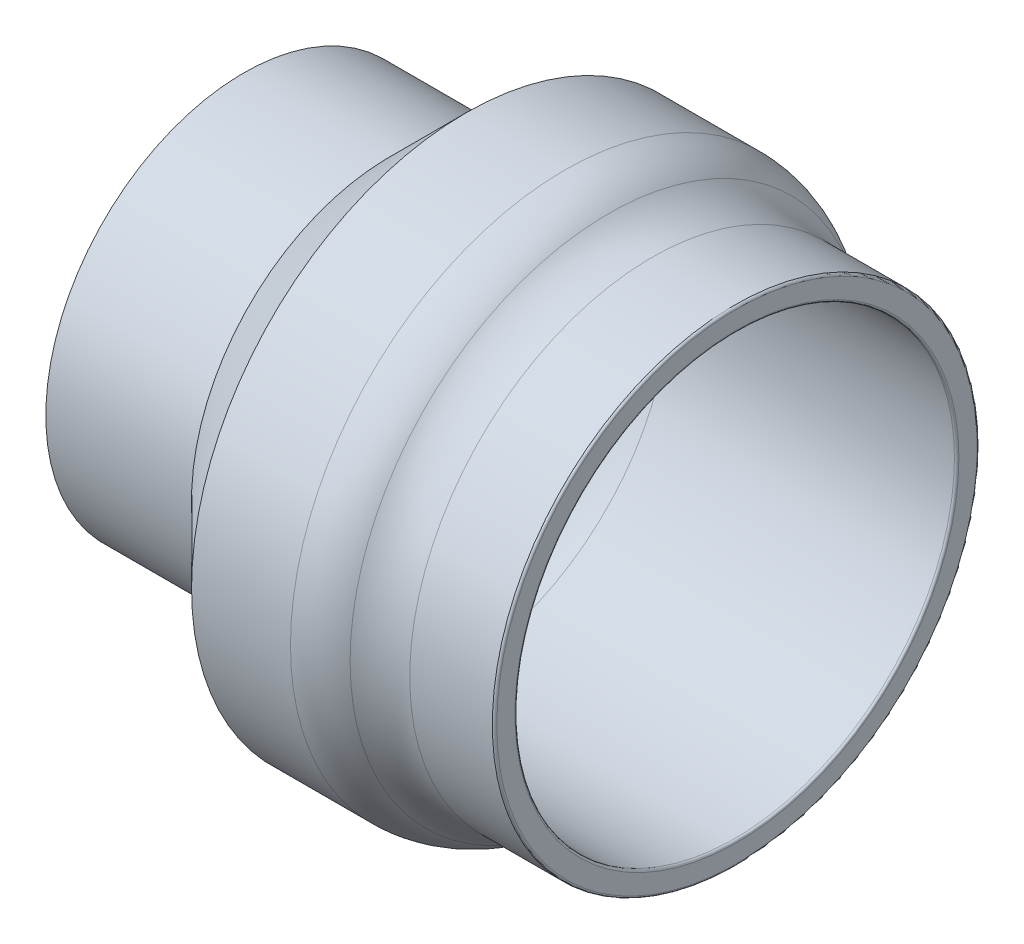
from build123d import *

# Parameters (mm, degrees)
SKETCH1_R           = 8.825
SKETCH1_R_2         = 7.825
BOSS_EXTRUDE1_DEPTH = 10
SKETCH2_R           = 12.24
SKETCH2_R_2         = 7.825
BOSS_EXTRUDE2_DEPTH = 12
CHAMFER1_SIZE       = 3.5
SKETCH3_R           = 9.8
CUT_EXTRUDE1_DEPTH  = 12
CHAMFER2_SIZE       = 4
FILLET1_R           = 3
SKETCH4_R           = 12.810143369
SKETCH4_R_2         = 10.810143369
CUT_EXTRUDE2_DEPTH  = 7
CHAMFER3_SIZE       = 2
FILLET2_R           = 3
FILLET3_R           = 3
FILLET4_R           = 0.1


with BuildPart() as part:
    # Sketch1 → Boss-Extrude1 (new body)
    with BuildSketch(Plane(origin=(0, 0, 0), x_dir=(0, 0, -1), z_dir=(1, 0, 0))):
        Circle(SKETCH1_R)
        Circle(SKETCH1_R_2, mode=Mode.SUBTRACT)
    extrude(amount=BOSS_EXTRUDE1_DEPTH)

    # Sketch2 → Boss-Extrude2 (add)
    with BuildSketch(Plane(origin=(10, 0, 0), x_dir=(0, 0, -1), z_dir=(1, 0, 0))):
        Circle(SKETCH2_R)
        Circle(SKETCH2_R_2, mode=Mode.SUBTRACT)
    extrude(amount=BOSS_EXTRUDE2_DEPTH)

    # Chamfer1
    # the kernel refuses this chamfer: 3.5 mm, written as the material it adds along each edge
    with BuildSketch(Plane(origin=(10, 0, 0), x_dir=(0, 0, -1), z_dir=(0, -1, 0))) as chamfer1_piece_1_section:
        Polygon((8.825, -CHAMFER1_SIZE), (8.825 + CHAMFER1_SIZE, 0), (8.825, 0), align=None)
    chamfer1_piece_1 = revolve(axis=Axis((10, 0, 0), (1, 0, 0)), mode=Mode.PRIVATE)
    chamfer1_piece_1 = chamfer1_piece_1 & Plane(origin=(8.210974628, 0, 0), x_dir=(0, 0, -1), z_dir=(-1, 0, 0)) * Cylinder(12.24, 50, mode=Mode.PRIVATE)
    add(chamfer1_piece_1)

    # Sketch3 → Cut-Extrude1 (cut)
    with BuildSketch(Plane(origin=(22, 0, 0), x_dir=(0, 0, -1), z_dir=(1, 0, 0))):
        Circle(SKETCH3_R)
    extrude(amount=-CUT_EXTRUDE1_DEPTH, mode=Mode.SUBTRACT)

    # Chamfer2
    # the kernel refuses this chamfer: 4 mm, written as the material it takes off along each edge
    with BuildSketch(Plane(origin=(10, 0, 0), x_dir=(0, 0, -1), z_dir=(0, 1, 0))) as chamfer2_piece_1_section:
        Polygon((7.825, CHAMFER2_SIZE), (7.825 + CHAMFER2_SIZE, 0), (7.825, 0), align=None)
    chamfer2_piece_1 = revolve(axis=Axis((10, 0, 0), (-1, 0, 0)), mode=Mode.PRIVATE)
    chamfer2_piece_1 = chamfer2_piece_1 & Plane(origin=(6.980894561, 0, 0), x_dir=(0, 0, -1), z_dir=(1, 0, 0)) * Cylinder(9.8, 48, mode=Mode.PRIVATE)
    add(chamfer2_piece_1, mode=Mode.SUBTRACT)

    # Fillet1
    fillet1_edges = [part.edges().sort_by_distance(p)[0] for p in [
        (6, 0, 7.825),
        (7.975, 0, 9.8),
    ]]
    fillet(fillet1_edges, radius=FILLET1_R)

    # Sketch4 → Cut-Extrude2 (cut)
    with BuildSketch(Plane(origin=(22, 0, 0), x_dir=(0, 0, -1), z_dir=(1, 0, 0))):
        Circle(SKETCH4_R)
        Circle(SKETCH4_R_2, mode=Mode.SUBTRACT)
    extrude(amount=-CUT_EXTRUDE2_DEPTH, mode=Mode.SUBTRACT)

    # Chamfer3
    # the kernel refuses this chamfer: 2 mm, written as the material it adds along each edge
    with BuildSketch(Plane(origin=(15, 0, 0), x_dir=(0, 0, -1), z_dir=(0, -1, 0))) as chamfer3_piece_1_section:
        Polygon((10.810143369 + CHAMFER3_SIZE, 0), (10.810143369, CHAMFER3_SIZE), (10.810143369, 0), align=None)
    chamfer3_piece_1 = revolve(axis=Axis((15, 0, 0), (1, 0, 0)), mode=Mode.PRIVATE)
    chamfer3_piece_1 = chamfer3_piece_1 & Plane(origin=(16.276433471, 0, 0), x_dir=(0, 0, -1), z_dir=(-1, 0, 0)) * Cylinder(12.24, 52, mode=Mode.PRIVATE)
    add(chamfer3_piece_1)

    # Fillet2
    fillet2_edges = [part.edges().sort_by_distance(p)[0] for p in [
        (15.570143369, 0, 12.24),
    ]]
    fillet(fillet2_edges, radius=FILLET2_R)

    # Fillet3
    fillet3_edges = [part.edges().sort_by_distance(p)[0] for p in [
        (17, 0, 10.810143369),
    ]]
    fillet(fillet3_edges, radius=FILLET3_R)

    # Fillet4
    fillet4_edges = [part.edges().sort_by_distance(p)[0] for p in [
        (22, 0, 9.8),
        (22, 0, 10.810143369),
    ]]
    fillet(fillet4_edges, radius=FILLET4_R)


solid = part.part
